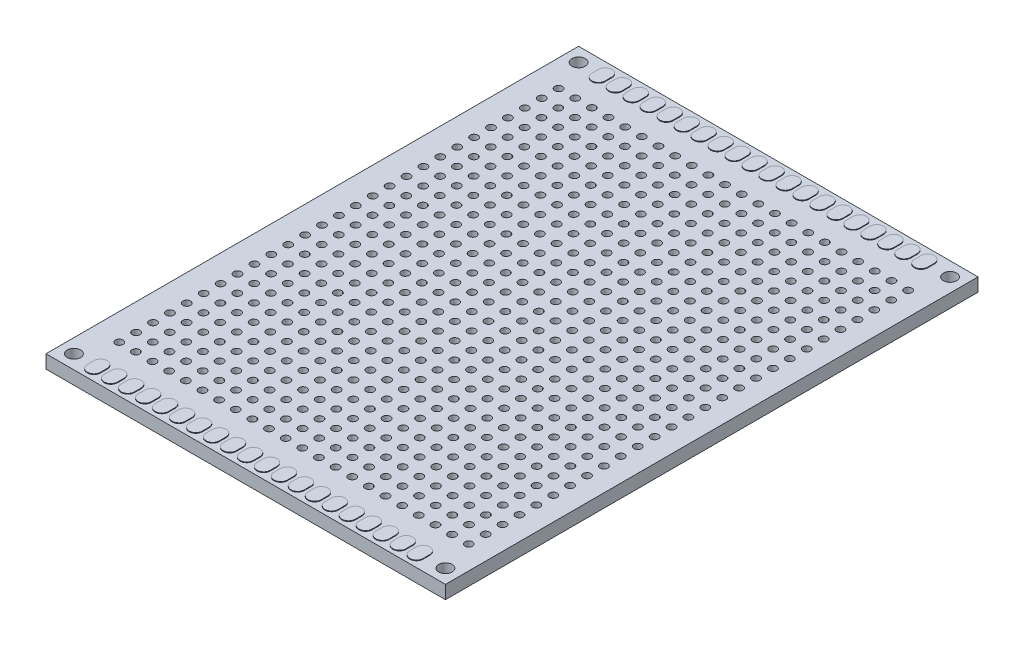
from build123d import *

# Parameters (mm, degrees)
SKETCH1_W           = 60
SKETCH1_H           = 80
SKETCH1_R           = 1
SKETCH1_R_2         = 0.575
BOSS_EXTRUDE1_DEPTH = 2
BOSS_EXTRUDE2_DEPTH = 0.1


with BuildPart() as part:
    # Sketch1 → Boss-Extrude1 (new body)
    with BuildSketch(Plane(origin=(0, 0, 0), x_dir=(1, 0, 0), z_dir=(0, 1, 0))):
        with Locations((30, 40)):
            Rectangle(SKETCH1_W, SKETCH1_H)
        with Locations((2.1, 77.9)):
            Circle(SKETCH1_R, mode=Mode.SUBTRACT)
        with Locations((57.9, 77.9)):
            Circle(SKETCH1_R, mode=Mode.SUBTRACT)
        with Locations((2.1, 2.1)):
            Circle(SKETCH1_R, mode=Mode.SUBTRACT)
        with Locations((57.9, 2.1)):
            Circle(SKETCH1_R, mode=Mode.SUBTRACT)
        with Locations((4, 73)):
            Circle(SKETCH1_R_2, mode=Mode.SUBTRACT)
        with Locations((6.5, 73)):
            Circle(SKETCH1_R_2, mode=Mode.SUBTRACT)
        with Locations((9, 73)):
            Circle(SKETCH1_R_2, mode=Mode.SUBTRACT)
        with Locations((11.5, 73)):
            Circle(SKETCH1_R_2, mode=Mode.SUBTRACT)
        with Locations((14, 73)):
            Circle(SKETCH1_R_2, mode=Mode.SUBTRACT)
        with Locations((16.5, 73)):
            Circle(SKETCH1_R_2, mode=Mode.SUBTRACT)
        with Locations((19, 73)):
            Circle(SKETCH1_R_2, mode=Mode.SUBTRACT)
        with Locations((21.5, 73)):
            Circle(SKETCH1_R_2, mode=Mode.SUBTRACT)
        with Locations((24, 73)):
            Circle(SKETCH1_R_2, mode=Mode.SUBTRACT)
        with Locations((26.5, 73)):
            Circle(SKETCH1_R_2, mode=Mode.SUBTRACT)
        with Locations((29, 73)):
            Circle(SKETCH1_R_2, mode=Mode.SUBTRACT)
        with Locations((31.5, 73)):
            Circle(SKETCH1_R_2, mode=Mode.SUBTRACT)
        with Locations((34, 73)):
            Circle(SKETCH1_R_2, mode=Mode.SUBTRACT)
        with Locations((36.5, 73)):
            Circle(SKETCH1_R_2, mode=Mode.SUBTRACT)
        with Locations((39, 73)):
            Circle(SKETCH1_R_2, mode=Mode.SUBTRACT)
        with Locations((41.5, 73)):
            Circle(SKETCH1_R_2, mode=Mode.SUBTRACT)
        with Locations((44, 73)):
            Circle(SKETCH1_R_2, mode=Mode.SUBTRACT)
        with Locations((46.5, 73)):
            Circle(SKETCH1_R_2, mode=Mode.SUBTRACT)
        with Locations((49, 73)):
            Circle(SKETCH1_R_2, mode=Mode.SUBTRACT)
        with Locations((51.5, 73)):
            Circle(SKETCH1_R_2, mode=Mode.SUBTRACT)
        with Locations((54, 73)):
            Circle(SKETCH1_R_2, mode=Mode.SUBTRACT)
        with Locations((56.5, 73)):
            Circle(SKETCH1_R_2, mode=Mode.SUBTRACT)
        with Locations((6.5, 70.461538462)):
            Circle(SKETCH1_R_2, mode=Mode.SUBTRACT)
        with Locations((9, 70.461538462)):
            Circle(SKETCH1_R_2, mode=Mode.SUBTRACT)
        with Locations((11.5, 70.461538462)):
            Circle(SKETCH1_R_2, mode=Mode.SUBTRACT)
        with Locations((14, 70.461538462)):
            Circle(SKETCH1_R_2, mode=Mode.SUBTRACT)
        with Locations((16.5, 70.461538462)):
            Circle(SKETCH1_R_2, mode=Mode.SUBTRACT)
        with Locations((19, 70.461538462)):
            Circle(SKETCH1_R_2, mode=Mode.SUBTRACT)
        with Locations((21.5, 70.461538462)):
            Circle(SKETCH1_R_2, mode=Mode.SUBTRACT)
        with Locations((24, 70.461538462)):
            Circle(SKETCH1_R_2, mode=Mode.SUBTRACT)
        with Locations((26.5, 70.461538462)):
            Circle(SKETCH1_R_2, mode=Mode.SUBTRACT)
        with Locations((29, 70.461538462)):
            Circle(SKETCH1_R_2, mode=Mode.SUBTRACT)
        with Locations((31.5, 70.461538462)):
            Circle(SKETCH1_R_2, mode=Mode.SUBTRACT)
        with Locations((34, 70.461538462)):
            Circle(SKETCH1_R_2, mode=Mode.SUBTRACT)
        with Locations((36.5, 70.461538462)):
            Circle(SKETCH1_R_2, mode=Mode.SUBTRACT)
        with Locations((39, 70.461538462)):
            Circle(SKETCH1_R_2, mode=Mode.SUBTRACT)
        with Locations((41.5, 70.461538462)):
            Circle(SKETCH1_R_2, mode=Mode.SUBTRACT)
        with Locations((44, 70.461538462)):
            Circle(SKETCH1_R_2, mode=Mode.SUBTRACT)
        with Locations((46.5, 70.461538462)):
            Circle(SKETCH1_R_2, mode=Mode.SUBTRACT)
        with Locations((49, 70.461538462)):
            Circle(SKETCH1_R_2, mode=Mode.SUBTRACT)
        with Locations((51.5, 70.461538462)):
            Circle(SKETCH1_R_2, mode=Mode.SUBTRACT)
        with Locations((54, 70.461538462)):
            Circle(SKETCH1_R_2, mode=Mode.SUBTRACT)
        with Locations((56.5, 70.461538462)):
            Circle(SKETCH1_R_2, mode=Mode.SUBTRACT)
        with Locations((6.5, 67.923076923)):
            Circle(SKETCH1_R_2, mode=Mode.SUBTRACT)
        with Locations((9, 67.923076923)):
            Circle(SKETCH1_R_2, mode=Mode.SUBTRACT)
        with Locations((11.5, 67.923076923)):
            Circle(SKETCH1_R_2, mode=Mode.SUBTRACT)
        with Locations((14, 67.923076923)):
            Circle(SKETCH1_R_2, mode=Mode.SUBTRACT)
        with Locations((16.5, 67.923076923)):
            Circle(SKETCH1_R_2, mode=Mode.SUBTRACT)
        with Locations((19, 67.923076923)):
            Circle(SKETCH1_R_2, mode=Mode.SUBTRACT)
        with Locations((21.5, 67.923076923)):
            Circle(SKETCH1_R_2, mode=Mode.SUBTRACT)
        with Locations((24, 67.923076923)):
            Circle(SKETCH1_R_2, mode=Mode.SUBTRACT)
        with Locations((26.5, 67.923076923)):
            Circle(SKETCH1_R_2, mode=Mode.SUBTRACT)
        with Locations((29, 67.923076923)):
            Circle(SKETCH1_R_2, mode=Mode.SUBTRACT)
        with Locations((31.5, 67.923076923)):
            Circle(SKETCH1_R_2, mode=Mode.SUBTRACT)
        with Locations((34, 67.923076923)):
            Circle(SKETCH1_R_2, mode=Mode.SUBTRACT)
        with Locations((36.5, 67.923076923)):
            Circle(SKETCH1_R_2, mode=Mode.SUBTRACT)
        with Locations((39, 67.923076923)):
            Circle(SKETCH1_R_2, mode=Mode.SUBTRACT)
        with Locations((41.5, 67.923076923)):
            Circle(SKETCH1_R_2, mode=Mode.SUBTRACT)
        with Locations((44, 67.923076923)):
            Circle(SKETCH1_R_2, mode=Mode.SUBTRACT)
        with Locations((46.5, 67.923076923)):
            Circle(SKETCH1_R_2, mode=Mode.SUBTRACT)
        with Locations((49, 67.923076923)):
            Circle(SKETCH1_R_2, mode=Mode.SUBTRACT)
        with Locations((51.5, 67.923076923)):
            Circle(SKETCH1_R_2, mode=Mode.SUBTRACT)
        with Locations((54, 67.923076923)):
            Circle(SKETCH1_R_2, mode=Mode.SUBTRACT)
        with Locations((56.5, 67.923076923)):
            Circle(SKETCH1_R_2, mode=Mode.SUBTRACT)
        with Locations((6.5, 65.384615385)):
            Circle(SKETCH1_R_2, mode=Mode.SUBTRACT)
        with Locations((9, 65.384615385)):
            Circle(SKETCH1_R_2, mode=Mode.SUBTRACT)
        with Locations((11.5, 65.384615385)):
            Circle(SKETCH1_R_2, mode=Mode.SUBTRACT)
        with Locations((14, 65.384615385)):
            Circle(SKETCH1_R_2, mode=Mode.SUBTRACT)
        with Locations((16.5, 65.384615385)):
            Circle(SKETCH1_R_2, mode=Mode.SUBTRACT)
        with Locations((19, 65.384615385)):
            Circle(SKETCH1_R_2, mode=Mode.SUBTRACT)
        with Locations((21.5, 65.384615385)):
            Circle(SKETCH1_R_2, mode=Mode.SUBTRACT)
        with Locations((24, 65.384615385)):
            Circle(SKETCH1_R_2, mode=Mode.SUBTRACT)
        with Locations((26.5, 65.384615385)):
            Circle(SKETCH1_R_2, mode=Mode.SUBTRACT)
        with Locations((29, 65.384615385)):
            Circle(SKETCH1_R_2, mode=Mode.SUBTRACT)
        with Locations((31.5, 65.384615385)):
            Circle(SKETCH1_R_2, mode=Mode.SUBTRACT)
        with Locations((34, 65.384615385)):
            Circle(SKETCH1_R_2, mode=Mode.SUBTRACT)
        with Locations((36.5, 65.384615385)):
            Circle(SKETCH1_R_2, mode=Mode.SUBTRACT)
        with Locations((39, 65.384615385)):
            Circle(SKETCH1_R_2, mode=Mode.SUBTRACT)
        with Locations((41.5, 65.384615385)):
            Circle(SKETCH1_R_2, mode=Mode.SUBTRACT)
        with Locations((44, 65.384615385)):
            Circle(SKETCH1_R_2, mode=Mode.SUBTRACT)
        with Locations((46.5, 65.384615385)):
            Circle(SKETCH1_R_2, mode=Mode.SUBTRACT)
        with Locations((49, 65.384615385)):
            Circle(SKETCH1_R_2, mode=Mode.SUBTRACT)
        with Locations((51.5, 65.384615385)):
            Circle(SKETCH1_R_2, mode=Mode.SUBTRACT)
        with Locations((54, 65.384615385)):
            Circle(SKETCH1_R_2, mode=Mode.SUBTRACT)
        with Locations((56.5, 65.384615385)):
            Circle(SKETCH1_R_2, mode=Mode.SUBTRACT)
        with Locations((6.5, 62.846153846)):
            Circle(SKETCH1_R_2, mode=Mode.SUBTRACT)
        with Locations((9, 62.846153846)):
            Circle(SKETCH1_R_2, mode=Mode.SUBTRACT)
        with Locations((11.5, 62.846153846)):
            Circle(SKETCH1_R_2, mode=Mode.SUBTRACT)
        with Locations((14, 62.846153846)):
            Circle(SKETCH1_R_2, mode=Mode.SUBTRACT)
        with Locations((16.5, 62.846153846)):
            Circle(SKETCH1_R_2, mode=Mode.SUBTRACT)
        with Locations((19, 62.846153846)):
            Circle(SKETCH1_R_2, mode=Mode.SUBTRACT)
        with Locations((21.5, 62.846153846)):
            Circle(SKETCH1_R_2, mode=Mode.SUBTRACT)
        with Locations((24, 62.846153846)):
            Circle(SKETCH1_R_2, mode=Mode.SUBTRACT)
        with Locations((26.5, 62.846153846)):
            Circle(SKETCH1_R_2, mode=Mode.SUBTRACT)
        with Locations((29, 62.846153846)):
            Circle(SKETCH1_R_2, mode=Mode.SUBTRACT)
        with Locations((31.5, 62.846153846)):
            Circle(SKETCH1_R_2, mode=Mode.SUBTRACT)
        with Locations((34, 62.846153846)):
            Circle(SKETCH1_R_2, mode=Mode.SUBTRACT)
        with Locations((36.5, 62.846153846)):
            Circle(SKETCH1_R_2, mode=Mode.SUBTRACT)
        with Locations((39, 62.846153846)):
            Circle(SKETCH1_R_2, mode=Mode.SUBTRACT)
        with Locations((41.5, 62.846153846)):
            Circle(SKETCH1_R_2, mode=Mode.SUBTRACT)
        with Locations((44, 62.846153846)):
            Circle(SKETCH1_R_2, mode=Mode.SUBTRACT)
        with Locations((46.5, 62.846153846)):
            Circle(SKETCH1_R_2, mode=Mode.SUBTRACT)
        with Locations((49, 62.846153846)):
            Circle(SKETCH1_R_2, mode=Mode.SUBTRACT)
        with Locations((51.5, 62.846153846)):
            Circle(SKETCH1_R_2, mode=Mode.SUBTRACT)
        with Locations((54, 62.846153846)):
            Circle(SKETCH1_R_2, mode=Mode.SUBTRACT)
        with Locations((56.5, 62.846153846)):
            Circle(SKETCH1_R_2, mode=Mode.SUBTRACT)
        with Locations((6.5, 60.307692308)):
            Circle(SKETCH1_R_2, mode=Mode.SUBTRACT)
        with Locations((9, 60.307692308)):
            Circle(SKETCH1_R_2, mode=Mode.SUBTRACT)
        with Locations((11.5, 60.307692308)):
            Circle(SKETCH1_R_2, mode=Mode.SUBTRACT)
        with Locations((14, 60.307692308)):
            Circle(SKETCH1_R_2, mode=Mode.SUBTRACT)
        with Locations((16.5, 60.307692308)):
            Circle(SKETCH1_R_2, mode=Mode.SUBTRACT)
        with Locations((19, 60.307692308)):
            Circle(SKETCH1_R_2, mode=Mode.SUBTRACT)
        with Locations((21.5, 60.307692308)):
            Circle(SKETCH1_R_2, mode=Mode.SUBTRACT)
        with Locations((24, 60.307692308)):
            Circle(SKETCH1_R_2, mode=Mode.SUBTRACT)
        with Locations((26.5, 60.307692308)):
            Circle(SKETCH1_R_2, mode=Mode.SUBTRACT)
        with Locations((29, 60.307692308)):
            Circle(SKETCH1_R_2, mode=Mode.SUBTRACT)
        with Locations((31.5, 60.307692308)):
            Circle(SKETCH1_R_2, mode=Mode.SUBTRACT)
        with Locations((34, 60.307692308)):
            Circle(SKETCH1_R_2, mode=Mode.SUBTRACT)
        with Locations((36.5, 60.307692308)):
            Circle(SKETCH1_R_2, mode=Mode.SUBTRACT)
        with Locations((39, 60.307692308)):
            Circle(SKETCH1_R_2, mode=Mode.SUBTRACT)
        with Locations((41.5, 60.307692308)):
            Circle(SKETCH1_R_2, mode=Mode.SUBTRACT)
        with Locations((44, 60.307692308)):
            Circle(SKETCH1_R_2, mode=Mode.SUBTRACT)
        with Locations((46.5, 60.307692308)):
            Circle(SKETCH1_R_2, mode=Mode.SUBTRACT)
        with Locations((49, 60.307692308)):
            Circle(SKETCH1_R_2, mode=Mode.SUBTRACT)
        with Locations((51.5, 60.307692308)):
            Circle(SKETCH1_R_2, mode=Mode.SUBTRACT)
        with Locations((54, 60.307692308)):
            Circle(SKETCH1_R_2, mode=Mode.SUBTRACT)
        with Locations((56.5, 60.307692308)):
            Circle(SKETCH1_R_2, mode=Mode.SUBTRACT)
        with Locations((6.5, 57.769230769)):
            Circle(SKETCH1_R_2, mode=Mode.SUBTRACT)
        with Locations((9, 57.769230769)):
            Circle(SKETCH1_R_2, mode=Mode.SUBTRACT)
        with Locations((11.5, 57.769230769)):
            Circle(SKETCH1_R_2, mode=Mode.SUBTRACT)
        with Locations((14, 57.769230769)):
            Circle(SKETCH1_R_2, mode=Mode.SUBTRACT)
        with Locations((16.5, 57.769230769)):
            Circle(SKETCH1_R_2, mode=Mode.SUBTRACT)
        with Locations((19, 57.769230769)):
            Circle(SKETCH1_R_2, mode=Mode.SUBTRACT)
        with Locations((21.5, 57.769230769)):
            Circle(SKETCH1_R_2, mode=Mode.SUBTRACT)
        with Locations((24, 57.769230769)):
            Circle(SKETCH1_R_2, mode=Mode.SUBTRACT)
        with Locations((26.5, 57.769230769)):
            Circle(SKETCH1_R_2, mode=Mode.SUBTRACT)
        with Locations((29, 57.769230769)):
            Circle(SKETCH1_R_2, mode=Mode.SUBTRACT)
        with Locations((31.5, 57.769230769)):
            Circle(SKETCH1_R_2, mode=Mode.SUBTRACT)
        with Locations((34, 57.769230769)):
            Circle(SKETCH1_R_2, mode=Mode.SUBTRACT)
        with Locations((36.5, 57.769230769)):
            Circle(SKETCH1_R_2, mode=Mode.SUBTRACT)
        with Locations((39, 57.769230769)):
            Circle(SKETCH1_R_2, mode=Mode.SUBTRACT)
        with Locations((41.5, 57.769230769)):
            Circle(SKETCH1_R_2, mode=Mode.SUBTRACT)
        with Locations((44, 57.769230769)):
            Circle(SKETCH1_R_2, mode=Mode.SUBTRACT)
        with Locations((46.5, 57.769230769)):
            Circle(SKETCH1_R_2, mode=Mode.SUBTRACT)
        with Locations((49, 57.769230769)):
            Circle(SKETCH1_R_2, mode=Mode.SUBTRACT)
        with Locations((51.5, 57.769230769)):
            Circle(SKETCH1_R_2, mode=Mode.SUBTRACT)
        with Locations((54, 57.769230769)):
            Circle(SKETCH1_R_2, mode=Mode.SUBTRACT)
        with Locations((56.5, 57.769230769)):
            Circle(SKETCH1_R_2, mode=Mode.SUBTRACT)
        with Locations((6.5, 55.230769231)):
            Circle(SKETCH1_R_2, mode=Mode.SUBTRACT)
        with Locations((9, 55.230769231)):
            Circle(SKETCH1_R_2, mode=Mode.SUBTRACT)
        with Locations((11.5, 55.230769231)):
            Circle(SKETCH1_R_2, mode=Mode.SUBTRACT)
        with Locations((14, 55.230769231)):
            Circle(SKETCH1_R_2, mode=Mode.SUBTRACT)
        with Locations((16.5, 55.230769231)):
            Circle(SKETCH1_R_2, mode=Mode.SUBTRACT)
        with Locations((19, 55.230769231)):
            Circle(SKETCH1_R_2, mode=Mode.SUBTRACT)
        with Locations((21.5, 55.230769231)):
            Circle(SKETCH1_R_2, mode=Mode.SUBTRACT)
        with Locations((24, 55.230769231)):
            Circle(SKETCH1_R_2, mode=Mode.SUBTRACT)
        with Locations((26.5, 55.230769231)):
            Circle(SKETCH1_R_2, mode=Mode.SUBTRACT)
        with Locations((29, 55.230769231)):
            Circle(SKETCH1_R_2, mode=Mode.SUBTRACT)
        with Locations((31.5, 55.230769231)):
            Circle(SKETCH1_R_2, mode=Mode.SUBTRACT)
        with Locations((34, 55.230769231)):
            Circle(SKETCH1_R_2, mode=Mode.SUBTRACT)
        with Locations((36.5, 55.230769231)):
            Circle(SKETCH1_R_2, mode=Mode.SUBTRACT)
        with Locations((39, 55.230769231)):
            Circle(SKETCH1_R_2, mode=Mode.SUBTRACT)
        with Locations((41.5, 55.230769231)):
            Circle(SKETCH1_R_2, mode=Mode.SUBTRACT)
        with Locations((44, 55.230769231)):
            Circle(SKETCH1_R_2, mode=Mode.SUBTRACT)
        with Locations((46.5, 55.230769231)):
            Circle(SKETCH1_R_2, mode=Mode.SUBTRACT)
        with Locations((49, 55.230769231)):
            Circle(SKETCH1_R_2, mode=Mode.SUBTRACT)
        with Locations((51.5, 55.230769231)):
            Circle(SKETCH1_R_2, mode=Mode.SUBTRACT)
        with Locations((54, 55.230769231)):
            Circle(SKETCH1_R_2, mode=Mode.SUBTRACT)
        with Locations((56.5, 55.230769231)):
            Circle(SKETCH1_R_2, mode=Mode.SUBTRACT)
        with Locations((6.5, 52.692307692)):
            Circle(SKETCH1_R_2, mode=Mode.SUBTRACT)
        with Locations((9, 52.692307692)):
            Circle(SKETCH1_R_2, mode=Mode.SUBTRACT)
        with Locations((11.5, 52.692307692)):
            Circle(SKETCH1_R_2, mode=Mode.SUBTRACT)
        with Locations((14, 52.692307692)):
            Circle(SKETCH1_R_2, mode=Mode.SUBTRACT)
        with Locations((16.5, 52.692307692)):
            Circle(SKETCH1_R_2, mode=Mode.SUBTRACT)
        with Locations((19, 52.692307692)):
            Circle(SKETCH1_R_2, mode=Mode.SUBTRACT)
        with Locations((21.5, 52.692307692)):
            Circle(SKETCH1_R_2, mode=Mode.SUBTRACT)
        with Locations((24, 52.692307692)):
            Circle(SKETCH1_R_2, mode=Mode.SUBTRACT)
        with Locations((26.5, 52.692307692)):
            Circle(SKETCH1_R_2, mode=Mode.SUBTRACT)
        with Locations((29, 52.692307692)):
            Circle(SKETCH1_R_2, mode=Mode.SUBTRACT)
        with Locations((31.5, 52.692307692)):
            Circle(SKETCH1_R_2, mode=Mode.SUBTRACT)
        with Locations((34, 52.692307692)):
            Circle(SKETCH1_R_2, mode=Mode.SUBTRACT)
        with Locations((36.5, 52.692307692)):
            Circle(SKETCH1_R_2, mode=Mode.SUBTRACT)
        with Locations((39, 52.692307692)):
            Circle(SKETCH1_R_2, mode=Mode.SUBTRACT)
        with Locations((41.5, 52.692307692)):
            Circle(SKETCH1_R_2, mode=Mode.SUBTRACT)
        with Locations((44, 52.692307692)):
            Circle(SKETCH1_R_2, mode=Mode.SUBTRACT)
        with Locations((46.5, 52.692307692)):
            Circle(SKETCH1_R_2, mode=Mode.SUBTRACT)
        with Locations((49, 52.692307692)):
            Circle(SKETCH1_R_2, mode=Mode.SUBTRACT)
        with Locations((51.5, 52.692307692)):
            Circle(SKETCH1_R_2, mode=Mode.SUBTRACT)
        with Locations((54, 52.692307692)):
            Circle(SKETCH1_R_2, mode=Mode.SUBTRACT)
        with Locations((56.5, 52.692307692)):
            Circle(SKETCH1_R_2, mode=Mode.SUBTRACT)
        with Locations((6.5, 50.153846154)):
            Circle(SKETCH1_R_2, mode=Mode.SUBTRACT)
        with Locations((9, 50.153846154)):
            Circle(SKETCH1_R_2, mode=Mode.SUBTRACT)
        with Locations((11.5, 50.153846154)):
            Circle(SKETCH1_R_2, mode=Mode.SUBTRACT)
        with Locations((14, 50.153846154)):
            Circle(SKETCH1_R_2, mode=Mode.SUBTRACT)
        with Locations((16.5, 50.153846154)):
            Circle(SKETCH1_R_2, mode=Mode.SUBTRACT)
        with Locations((19, 50.153846154)):
            Circle(SKETCH1_R_2, mode=Mode.SUBTRACT)
        with Locations((21.5, 50.153846154)):
            Circle(SKETCH1_R_2, mode=Mode.SUBTRACT)
        with Locations((24, 50.153846154)):
            Circle(SKETCH1_R_2, mode=Mode.SUBTRACT)
        with Locations((26.5, 50.153846154)):
            Circle(SKETCH1_R_2, mode=Mode.SUBTRACT)
        with Locations((29, 50.153846154)):
            Circle(SKETCH1_R_2, mode=Mode.SUBTRACT)
        with Locations((31.5, 50.153846154)):
            Circle(SKETCH1_R_2, mode=Mode.SUBTRACT)
        with Locations((34, 50.153846154)):
            Circle(SKETCH1_R_2, mode=Mode.SUBTRACT)
        with Locations((36.5, 50.153846154)):
            Circle(SKETCH1_R_2, mode=Mode.SUBTRACT)
        with Locations((39, 50.153846154)):
            Circle(SKETCH1_R_2, mode=Mode.SUBTRACT)
        with Locations((41.5, 50.153846154)):
            Circle(SKETCH1_R_2, mode=Mode.SUBTRACT)
        with Locations((44, 50.153846154)):
            Circle(SKETCH1_R_2, mode=Mode.SUBTRACT)
        with Locations((46.5, 50.153846154)):
            Circle(SKETCH1_R_2, mode=Mode.SUBTRACT)
        with Locations((49, 50.153846154)):
            Circle(SKETCH1_R_2, mode=Mode.SUBTRACT)
        with Locations((51.5, 50.153846154)):
            Circle(SKETCH1_R_2, mode=Mode.SUBTRACT)
        with Locations((54, 50.153846154)):
            Circle(SKETCH1_R_2, mode=Mode.SUBTRACT)
        with Locations((56.5, 50.153846154)):
            Circle(SKETCH1_R_2, mode=Mode.SUBTRACT)
        with Locations((6.5, 47.615384615)):
            Circle(SKETCH1_R_2, mode=Mode.SUBTRACT)
        with Locations((9, 47.615384615)):
            Circle(SKETCH1_R_2, mode=Mode.SUBTRACT)
        with Locations((11.5, 47.615384615)):
            Circle(SKETCH1_R_2, mode=Mode.SUBTRACT)
        with Locations((14, 47.615384615)):
            Circle(SKETCH1_R_2, mode=Mode.SUBTRACT)
        with Locations((16.5, 47.615384615)):
            Circle(SKETCH1_R_2, mode=Mode.SUBTRACT)
        with Locations((19, 47.615384615)):
            Circle(SKETCH1_R_2, mode=Mode.SUBTRACT)
        with Locations((21.5, 47.615384615)):
            Circle(SKETCH1_R_2, mode=Mode.SUBTRACT)
        with Locations((24, 47.615384615)):
            Circle(SKETCH1_R_2, mode=Mode.SUBTRACT)
        with Locations((26.5, 47.615384615)):
            Circle(SKETCH1_R_2, mode=Mode.SUBTRACT)
        with Locations((29, 47.615384615)):
            Circle(SKETCH1_R_2, mode=Mode.SUBTRACT)
        with Locations((31.5, 47.615384615)):
            Circle(SKETCH1_R_2, mode=Mode.SUBTRACT)
        with Locations((34, 47.615384615)):
            Circle(SKETCH1_R_2, mode=Mode.SUBTRACT)
        with Locations((36.5, 47.615384615)):
            Circle(SKETCH1_R_2, mode=Mode.SUBTRACT)
        with Locations((39, 47.615384615)):
            Circle(SKETCH1_R_2, mode=Mode.SUBTRACT)
        with Locations((41.5, 47.615384615)):
            Circle(SKETCH1_R_2, mode=Mode.SUBTRACT)
        with Locations((44, 47.615384615)):
            Circle(SKETCH1_R_2, mode=Mode.SUBTRACT)
        with Locations((46.5, 47.615384615)):
            Circle(SKETCH1_R_2, mode=Mode.SUBTRACT)
        with Locations((49, 47.615384615)):
            Circle(SKETCH1_R_2, mode=Mode.SUBTRACT)
        with Locations((51.5, 47.615384615)):
            Circle(SKETCH1_R_2, mode=Mode.SUBTRACT)
        with Locations((54, 47.615384615)):
            Circle(SKETCH1_R_2, mode=Mode.SUBTRACT)
        with Locations((56.5, 47.615384615)):
            Circle(SKETCH1_R_2, mode=Mode.SUBTRACT)
        with Locations((6.5, 45.076923077)):
            Circle(SKETCH1_R_2, mode=Mode.SUBTRACT)
        with Locations((9, 45.076923077)):
            Circle(SKETCH1_R_2, mode=Mode.SUBTRACT)
        with Locations((11.5, 45.076923077)):
            Circle(SKETCH1_R_2, mode=Mode.SUBTRACT)
        with Locations((14, 45.076923077)):
            Circle(SKETCH1_R_2, mode=Mode.SUBTRACT)
        with Locations((16.5, 45.076923077)):
            Circle(SKETCH1_R_2, mode=Mode.SUBTRACT)
        with Locations((19, 45.076923077)):
            Circle(SKETCH1_R_2, mode=Mode.SUBTRACT)
        with Locations((21.5, 45.076923077)):
            Circle(SKETCH1_R_2, mode=Mode.SUBTRACT)
        with Locations((24, 45.076923077)):
            Circle(SKETCH1_R_2, mode=Mode.SUBTRACT)
        with Locations((26.5, 45.076923077)):
            Circle(SKETCH1_R_2, mode=Mode.SUBTRACT)
        with Locations((29, 45.076923077)):
            Circle(SKETCH1_R_2, mode=Mode.SUBTRACT)
        with Locations((31.5, 45.076923077)):
            Circle(SKETCH1_R_2, mode=Mode.SUBTRACT)
        with Locations((34, 45.076923077)):
            Circle(SKETCH1_R_2, mode=Mode.SUBTRACT)
        with Locations((36.5, 45.076923077)):
            Circle(SKETCH1_R_2, mode=Mode.SUBTRACT)
        with Locations((39, 45.076923077)):
            Circle(SKETCH1_R_2, mode=Mode.SUBTRACT)
        with Locations((41.5, 45.076923077)):
            Circle(SKETCH1_R_2, mode=Mode.SUBTRACT)
        with Locations((44, 45.076923077)):
            Circle(SKETCH1_R_2, mode=Mode.SUBTRACT)
        with Locations((46.5, 45.076923077)):
            Circle(SKETCH1_R_2, mode=Mode.SUBTRACT)
        with Locations((49, 45.076923077)):
            Circle(SKETCH1_R_2, mode=Mode.SUBTRACT)
        with Locations((51.5, 45.076923077)):
            Circle(SKETCH1_R_2, mode=Mode.SUBTRACT)
        with Locations((54, 45.076923077)):
            Circle(SKETCH1_R_2, mode=Mode.SUBTRACT)
        with Locations((56.5, 45.076923077)):
            Circle(SKETCH1_R_2, mode=Mode.SUBTRACT)
        with Locations((6.5, 42.538461538)):
            Circle(SKETCH1_R_2, mode=Mode.SUBTRACT)
        with Locations((9, 42.538461538)):
            Circle(SKETCH1_R_2, mode=Mode.SUBTRACT)
        with Locations((11.5, 42.538461538)):
            Circle(SKETCH1_R_2, mode=Mode.SUBTRACT)
        with Locations((14, 42.538461538)):
            Circle(SKETCH1_R_2, mode=Mode.SUBTRACT)
        with Locations((16.5, 42.538461538)):
            Circle(SKETCH1_R_2, mode=Mode.SUBTRACT)
        with Locations((19, 42.538461538)):
            Circle(SKETCH1_R_2, mode=Mode.SUBTRACT)
        with Locations((21.5, 42.538461538)):
            Circle(SKETCH1_R_2, mode=Mode.SUBTRACT)
        with Locations((24, 42.538461538)):
            Circle(SKETCH1_R_2, mode=Mode.SUBTRACT)
        with Locations((26.5, 42.538461538)):
            Circle(SKETCH1_R_2, mode=Mode.SUBTRACT)
        with Locations((29, 42.538461538)):
            Circle(SKETCH1_R_2, mode=Mode.SUBTRACT)
        with Locations((31.5, 42.538461538)):
            Circle(SKETCH1_R_2, mode=Mode.SUBTRACT)
        with Locations((34, 42.538461538)):
            Circle(SKETCH1_R_2, mode=Mode.SUBTRACT)
        with Locations((36.5, 42.538461538)):
            Circle(SKETCH1_R_2, mode=Mode.SUBTRACT)
        with Locations((39, 42.538461538)):
            Circle(SKETCH1_R_2, mode=Mode.SUBTRACT)
        with Locations((41.5, 42.538461538)):
            Circle(SKETCH1_R_2, mode=Mode.SUBTRACT)
        with Locations((44, 42.538461538)):
            Circle(SKETCH1_R_2, mode=Mode.SUBTRACT)
        with Locations((46.5, 42.538461538)):
            Circle(SKETCH1_R_2, mode=Mode.SUBTRACT)
        with Locations((49, 42.538461538)):
            Circle(SKETCH1_R_2, mode=Mode.SUBTRACT)
        with Locations((51.5, 42.538461538)):
            Circle(SKETCH1_R_2, mode=Mode.SUBTRACT)
        with Locations((54, 42.538461538)):
            Circle(SKETCH1_R_2, mode=Mode.SUBTRACT)
        with Locations((56.5, 42.538461538)):
            Circle(SKETCH1_R_2, mode=Mode.SUBTRACT)
        with Locations((6.5, 40)):
            Circle(SKETCH1_R_2, mode=Mode.SUBTRACT)
        with Locations((9, 40)):
            Circle(SKETCH1_R_2, mode=Mode.SUBTRACT)
        with Locations((11.5, 40)):
            Circle(SKETCH1_R_2, mode=Mode.SUBTRACT)
        with Locations((14, 40)):
            Circle(SKETCH1_R_2, mode=Mode.SUBTRACT)
        with Locations((16.5, 40)):
            Circle(SKETCH1_R_2, mode=Mode.SUBTRACT)
        with Locations((19, 40)):
            Circle(SKETCH1_R_2, mode=Mode.SUBTRACT)
        with Locations((21.5, 40)):
            Circle(SKETCH1_R_2, mode=Mode.SUBTRACT)
        with Locations((24, 40)):
            Circle(SKETCH1_R_2, mode=Mode.SUBTRACT)
        with Locations((26.5, 40)):
            Circle(SKETCH1_R_2, mode=Mode.SUBTRACT)
        with Locations((29, 40)):
            Circle(SKETCH1_R_2, mode=Mode.SUBTRACT)
        with Locations((31.5, 40)):
            Circle(SKETCH1_R_2, mode=Mode.SUBTRACT)
        with Locations((34, 40)):
            Circle(SKETCH1_R_2, mode=Mode.SUBTRACT)
        with Locations((36.5, 40)):
            Circle(SKETCH1_R_2, mode=Mode.SUBTRACT)
        with Locations((39, 40)):
            Circle(SKETCH1_R_2, mode=Mode.SUBTRACT)
        with Locations((41.5, 40)):
            Circle(SKETCH1_R_2, mode=Mode.SUBTRACT)
        with Locations((44, 40)):
            Circle(SKETCH1_R_2, mode=Mode.SUBTRACT)
        with Locations((46.5, 40)):
            Circle(SKETCH1_R_2, mode=Mode.SUBTRACT)
        with Locations((49, 40)):
            Circle(SKETCH1_R_2, mode=Mode.SUBTRACT)
        with Locations((51.5, 40)):
            Circle(SKETCH1_R_2, mode=Mode.SUBTRACT)
        with Locations((54, 40)):
            Circle(SKETCH1_R_2, mode=Mode.SUBTRACT)
        with Locations((56.5, 40)):
            Circle(SKETCH1_R_2, mode=Mode.SUBTRACT)
        with Locations((6.5, 37.461538462)):
            Circle(SKETCH1_R_2, mode=Mode.SUBTRACT)
        with Locations((9, 37.461538462)):
            Circle(SKETCH1_R_2, mode=Mode.SUBTRACT)
        with Locations((11.5, 37.461538462)):
            Circle(SKETCH1_R_2, mode=Mode.SUBTRACT)
        with Locations((14, 37.461538462)):
            Circle(SKETCH1_R_2, mode=Mode.SUBTRACT)
        with Locations((16.5, 37.461538462)):
            Circle(SKETCH1_R_2, mode=Mode.SUBTRACT)
        with Locations((19, 37.461538462)):
            Circle(SKETCH1_R_2, mode=Mode.SUBTRACT)
        with Locations((21.5, 37.461538462)):
            Circle(SKETCH1_R_2, mode=Mode.SUBTRACT)
        with Locations((24, 37.461538462)):
            Circle(SKETCH1_R_2, mode=Mode.SUBTRACT)
        with Locations((26.5, 37.461538462)):
            Circle(SKETCH1_R_2, mode=Mode.SUBTRACT)
        with Locations((29, 37.461538462)):
            Circle(SKETCH1_R_2, mode=Mode.SUBTRACT)
        with Locations((31.5, 37.461538462)):
            Circle(SKETCH1_R_2, mode=Mode.SUBTRACT)
        with Locations((34, 37.461538462)):
            Circle(SKETCH1_R_2, mode=Mode.SUBTRACT)
        with Locations((36.5, 37.461538462)):
            Circle(SKETCH1_R_2, mode=Mode.SUBTRACT)
        with Locations((39, 37.461538462)):
            Circle(SKETCH1_R_2, mode=Mode.SUBTRACT)
        with Locations((41.5, 37.461538462)):
            Circle(SKETCH1_R_2, mode=Mode.SUBTRACT)
        with Locations((44, 37.461538462)):
            Circle(SKETCH1_R_2, mode=Mode.SUBTRACT)
        with Locations((46.5, 37.461538462)):
            Circle(SKETCH1_R_2, mode=Mode.SUBTRACT)
        with Locations((49, 37.461538462)):
            Circle(SKETCH1_R_2, mode=Mode.SUBTRACT)
        with Locations((51.5, 37.461538462)):
            Circle(SKETCH1_R_2, mode=Mode.SUBTRACT)
        with Locations((54, 37.461538462)):
            Circle(SKETCH1_R_2, mode=Mode.SUBTRACT)
        with Locations((56.5, 37.461538462)):
            Circle(SKETCH1_R_2, mode=Mode.SUBTRACT)
        with Locations((6.5, 34.923076923)):
            Circle(SKETCH1_R_2, mode=Mode.SUBTRACT)
        with Locations((9, 34.923076923)):
            Circle(SKETCH1_R_2, mode=Mode.SUBTRACT)
        with Locations((11.5, 34.923076923)):
            Circle(SKETCH1_R_2, mode=Mode.SUBTRACT)
        with Locations((14, 34.923076923)):
            Circle(SKETCH1_R_2, mode=Mode.SUBTRACT)
        with Locations((16.5, 34.923076923)):
            Circle(SKETCH1_R_2, mode=Mode.SUBTRACT)
        with Locations((19, 34.923076923)):
            Circle(SKETCH1_R_2, mode=Mode.SUBTRACT)
        with Locations((21.5, 34.923076923)):
            Circle(SKETCH1_R_2, mode=Mode.SUBTRACT)
        with Locations((24, 34.923076923)):
            Circle(SKETCH1_R_2, mode=Mode.SUBTRACT)
        with Locations((26.5, 34.923076923)):
            Circle(SKETCH1_R_2, mode=Mode.SUBTRACT)
        with Locations((29, 34.923076923)):
            Circle(SKETCH1_R_2, mode=Mode.SUBTRACT)
        with Locations((31.5, 34.923076923)):
            Circle(SKETCH1_R_2, mode=Mode.SUBTRACT)
        with Locations((34, 34.923076923)):
            Circle(SKETCH1_R_2, mode=Mode.SUBTRACT)
        with Locations((36.5, 34.923076923)):
            Circle(SKETCH1_R_2, mode=Mode.SUBTRACT)
        with Locations((39, 34.923076923)):
            Circle(SKETCH1_R_2, mode=Mode.SUBTRACT)
        with Locations((41.5, 34.923076923)):
            Circle(SKETCH1_R_2, mode=Mode.SUBTRACT)
        with Locations((44, 34.923076923)):
            Circle(SKETCH1_R_2, mode=Mode.SUBTRACT)
        with Locations((46.5, 34.923076923)):
            Circle(SKETCH1_R_2, mode=Mode.SUBTRACT)
        with Locations((49, 34.923076923)):
            Circle(SKETCH1_R_2, mode=Mode.SUBTRACT)
        with Locations((51.5, 34.923076923)):
            Circle(SKETCH1_R_2, mode=Mode.SUBTRACT)
        with Locations((54, 34.923076923)):
            Circle(SKETCH1_R_2, mode=Mode.SUBTRACT)
        with Locations((56.5, 34.923076923)):
            Circle(SKETCH1_R_2, mode=Mode.SUBTRACT)
        with Locations((6.5, 32.384615385)):
            Circle(SKETCH1_R_2, mode=Mode.SUBTRACT)
        with Locations((9, 32.384615385)):
            Circle(SKETCH1_R_2, mode=Mode.SUBTRACT)
        with Locations((11.5, 32.384615385)):
            Circle(SKETCH1_R_2, mode=Mode.SUBTRACT)
        with Locations((14, 32.384615385)):
            Circle(SKETCH1_R_2, mode=Mode.SUBTRACT)
        with Locations((16.5, 32.384615385)):
            Circle(SKETCH1_R_2, mode=Mode.SUBTRACT)
        with Locations((19, 32.384615385)):
            Circle(SKETCH1_R_2, mode=Mode.SUBTRACT)
        with Locations((21.5, 32.384615385)):
            Circle(SKETCH1_R_2, mode=Mode.SUBTRACT)
        with Locations((24, 32.384615385)):
            Circle(SKETCH1_R_2, mode=Mode.SUBTRACT)
        with Locations((26.5, 32.384615385)):
            Circle(SKETCH1_R_2, mode=Mode.SUBTRACT)
        with Locations((29, 32.384615385)):
            Circle(SKETCH1_R_2, mode=Mode.SUBTRACT)
        with Locations((31.5, 32.384615385)):
            Circle(SKETCH1_R_2, mode=Mode.SUBTRACT)
        with Locations((34, 32.384615385)):
            Circle(SKETCH1_R_2, mode=Mode.SUBTRACT)
        with Locations((36.5, 32.384615385)):
            Circle(SKETCH1_R_2, mode=Mode.SUBTRACT)
        with Locations((39, 32.384615385)):
            Circle(SKETCH1_R_2, mode=Mode.SUBTRACT)
        with Locations((41.5, 32.384615385)):
            Circle(SKETCH1_R_2, mode=Mode.SUBTRACT)
        with Locations((44, 32.384615385)):
            Circle(SKETCH1_R_2, mode=Mode.SUBTRACT)
        with Locations((46.5, 32.384615385)):
            Circle(SKETCH1_R_2, mode=Mode.SUBTRACT)
        with Locations((49, 32.384615385)):
            Circle(SKETCH1_R_2, mode=Mode.SUBTRACT)
        with Locations((51.5, 32.384615385)):
            Circle(SKETCH1_R_2, mode=Mode.SUBTRACT)
        with Locations((54, 32.384615385)):
            Circle(SKETCH1_R_2, mode=Mode.SUBTRACT)
        with Locations((56.5, 32.384615385)):
            Circle(SKETCH1_R_2, mode=Mode.SUBTRACT)
        with Locations((6.5, 29.846153846)):
            Circle(SKETCH1_R_2, mode=Mode.SUBTRACT)
        with Locations((9, 29.846153846)):
            Circle(SKETCH1_R_2, mode=Mode.SUBTRACT)
        with Locations((11.5, 29.846153846)):
            Circle(SKETCH1_R_2, mode=Mode.SUBTRACT)
        with Locations((14, 29.846153846)):
            Circle(SKETCH1_R_2, mode=Mode.SUBTRACT)
        with Locations((16.5, 29.846153846)):
            Circle(SKETCH1_R_2, mode=Mode.SUBTRACT)
        with Locations((19, 29.846153846)):
            Circle(SKETCH1_R_2, mode=Mode.SUBTRACT)
        with Locations((21.5, 29.846153846)):
            Circle(SKETCH1_R_2, mode=Mode.SUBTRACT)
        with Locations((24, 29.846153846)):
            Circle(SKETCH1_R_2, mode=Mode.SUBTRACT)
        with Locations((26.5, 29.846153846)):
            Circle(SKETCH1_R_2, mode=Mode.SUBTRACT)
        with Locations((29, 29.846153846)):
            Circle(SKETCH1_R_2, mode=Mode.SUBTRACT)
        with Locations((31.5, 29.846153846)):
            Circle(SKETCH1_R_2, mode=Mode.SUBTRACT)
        with Locations((34, 29.846153846)):
            Circle(SKETCH1_R_2, mode=Mode.SUBTRACT)
        with Locations((36.5, 29.846153846)):
            Circle(SKETCH1_R_2, mode=Mode.SUBTRACT)
        with Locations((39, 29.846153846)):
            Circle(SKETCH1_R_2, mode=Mode.SUBTRACT)
        with Locations((41.5, 29.846153846)):
            Circle(SKETCH1_R_2, mode=Mode.SUBTRACT)
        with Locations((44, 29.846153846)):
            Circle(SKETCH1_R_2, mode=Mode.SUBTRACT)
        with Locations((46.5, 29.846153846)):
            Circle(SKETCH1_R_2, mode=Mode.SUBTRACT)
        with Locations((49, 29.846153846)):
            Circle(SKETCH1_R_2, mode=Mode.SUBTRACT)
        with Locations((51.5, 29.846153846)):
            Circle(SKETCH1_R_2, mode=Mode.SUBTRACT)
        with Locations((54, 29.846153846)):
            Circle(SKETCH1_R_2, mode=Mode.SUBTRACT)
        with Locations((56.5, 29.846153846)):
            Circle(SKETCH1_R_2, mode=Mode.SUBTRACT)
        with Locations((6.5, 27.307692308)):
            Circle(SKETCH1_R_2, mode=Mode.SUBTRACT)
        with Locations((9, 27.307692308)):
            Circle(SKETCH1_R_2, mode=Mode.SUBTRACT)
        with Locations((11.5, 27.307692308)):
            Circle(SKETCH1_R_2, mode=Mode.SUBTRACT)
        with Locations((14, 27.307692308)):
            Circle(SKETCH1_R_2, mode=Mode.SUBTRACT)
        with Locations((16.5, 27.307692308)):
            Circle(SKETCH1_R_2, mode=Mode.SUBTRACT)
        with Locations((19, 27.307692308)):
            Circle(SKETCH1_R_2, mode=Mode.SUBTRACT)
        with Locations((21.5, 27.307692308)):
            Circle(SKETCH1_R_2, mode=Mode.SUBTRACT)
        with Locations((24, 27.307692308)):
            Circle(SKETCH1_R_2, mode=Mode.SUBTRACT)
        with Locations((26.5, 27.307692308)):
            Circle(SKETCH1_R_2, mode=Mode.SUBTRACT)
        with Locations((29, 27.307692308)):
            Circle(SKETCH1_R_2, mode=Mode.SUBTRACT)
        with Locations((31.5, 27.307692308)):
            Circle(SKETCH1_R_2, mode=Mode.SUBTRACT)
        with Locations((34, 27.307692308)):
            Circle(SKETCH1_R_2, mode=Mode.SUBTRACT)
        with Locations((36.5, 27.307692308)):
            Circle(SKETCH1_R_2, mode=Mode.SUBTRACT)
        with Locations((39, 27.307692308)):
            Circle(SKETCH1_R_2, mode=Mode.SUBTRACT)
        with Locations((41.5, 27.307692308)):
            Circle(SKETCH1_R_2, mode=Mode.SUBTRACT)
        with Locations((44, 27.307692308)):
            Circle(SKETCH1_R_2, mode=Mode.SUBTRACT)
        with Locations((46.5, 27.307692308)):
            Circle(SKETCH1_R_2, mode=Mode.SUBTRACT)
        with Locations((49, 27.307692308)):
            Circle(SKETCH1_R_2, mode=Mode.SUBTRACT)
        with Locations((51.5, 27.307692308)):
            Circle(SKETCH1_R_2, mode=Mode.SUBTRACT)
        with Locations((54, 27.307692308)):
            Circle(SKETCH1_R_2, mode=Mode.SUBTRACT)
        with Locations((56.5, 27.307692308)):
            Circle(SKETCH1_R_2, mode=Mode.SUBTRACT)
        with Locations((6.5, 24.769230769)):
            Circle(SKETCH1_R_2, mode=Mode.SUBTRACT)
        with Locations((9, 24.769230769)):
            Circle(SKETCH1_R_2, mode=Mode.SUBTRACT)
        with Locations((11.5, 24.769230769)):
            Circle(SKETCH1_R_2, mode=Mode.SUBTRACT)
        with Locations((14, 24.769230769)):
            Circle(SKETCH1_R_2, mode=Mode.SUBTRACT)
        with Locations((16.5, 24.769230769)):
            Circle(SKETCH1_R_2, mode=Mode.SUBTRACT)
        with Locations((19, 24.769230769)):
            Circle(SKETCH1_R_2, mode=Mode.SUBTRACT)
        with Locations((21.5, 24.769230769)):
            Circle(SKETCH1_R_2, mode=Mode.SUBTRACT)
        with Locations((24, 24.769230769)):
            Circle(SKETCH1_R_2, mode=Mode.SUBTRACT)
        with Locations((26.5, 24.769230769)):
            Circle(SKETCH1_R_2, mode=Mode.SUBTRACT)
        with Locations((29, 24.769230769)):
            Circle(SKETCH1_R_2, mode=Mode.SUBTRACT)
        with Locations((31.5, 24.769230769)):
            Circle(SKETCH1_R_2, mode=Mode.SUBTRACT)
        with Locations((34, 24.769230769)):
            Circle(SKETCH1_R_2, mode=Mode.SUBTRACT)
        with Locations((36.5, 24.769230769)):
            Circle(SKETCH1_R_2, mode=Mode.SUBTRACT)
        with Locations((39, 24.769230769)):
            Circle(SKETCH1_R_2, mode=Mode.SUBTRACT)
        with Locations((41.5, 24.769230769)):
            Circle(SKETCH1_R_2, mode=Mode.SUBTRACT)
        with Locations((44, 24.769230769)):
            Circle(SKETCH1_R_2, mode=Mode.SUBTRACT)
        with Locations((46.5, 24.769230769)):
            Circle(SKETCH1_R_2, mode=Mode.SUBTRACT)
        with Locations((49, 24.769230769)):
            Circle(SKETCH1_R_2, mode=Mode.SUBTRACT)
        with Locations((51.5, 24.769230769)):
            Circle(SKETCH1_R_2, mode=Mode.SUBTRACT)
        with Locations((54, 24.769230769)):
            Circle(SKETCH1_R_2, mode=Mode.SUBTRACT)
        with Locations((56.5, 24.769230769)):
            Circle(SKETCH1_R_2, mode=Mode.SUBTRACT)
        with Locations((6.5, 22.230769231)):
            Circle(SKETCH1_R_2, mode=Mode.SUBTRACT)
        with Locations((9, 22.230769231)):
            Circle(SKETCH1_R_2, mode=Mode.SUBTRACT)
        with Locations((11.5, 22.230769231)):
            Circle(SKETCH1_R_2, mode=Mode.SUBTRACT)
        with Locations((14, 22.230769231)):
            Circle(SKETCH1_R_2, mode=Mode.SUBTRACT)
        with Locations((16.5, 22.230769231)):
            Circle(SKETCH1_R_2, mode=Mode.SUBTRACT)
        with Locations((19, 22.230769231)):
            Circle(SKETCH1_R_2, mode=Mode.SUBTRACT)
        with Locations((21.5, 22.230769231)):
            Circle(SKETCH1_R_2, mode=Mode.SUBTRACT)
        with Locations((24, 22.230769231)):
            Circle(SKETCH1_R_2, mode=Mode.SUBTRACT)
        with Locations((26.5, 22.230769231)):
            Circle(SKETCH1_R_2, mode=Mode.SUBTRACT)
        with Locations((29, 22.230769231)):
            Circle(SKETCH1_R_2, mode=Mode.SUBTRACT)
        with Locations((31.5, 22.230769231)):
            Circle(SKETCH1_R_2, mode=Mode.SUBTRACT)
        with Locations((34, 22.230769231)):
            Circle(SKETCH1_R_2, mode=Mode.SUBTRACT)
        with Locations((36.5, 22.230769231)):
            Circle(SKETCH1_R_2, mode=Mode.SUBTRACT)
        with Locations((39, 22.230769231)):
            Circle(SKETCH1_R_2, mode=Mode.SUBTRACT)
        with Locations((41.5, 22.230769231)):
            Circle(SKETCH1_R_2, mode=Mode.SUBTRACT)
        with Locations((44, 22.230769231)):
            Circle(SKETCH1_R_2, mode=Mode.SUBTRACT)
        with Locations((46.5, 22.230769231)):
            Circle(SKETCH1_R_2, mode=Mode.SUBTRACT)
        with Locations((49, 22.230769231)):
            Circle(SKETCH1_R_2, mode=Mode.SUBTRACT)
        with Locations((51.5, 22.230769231)):
            Circle(SKETCH1_R_2, mode=Mode.SUBTRACT)
        with Locations((54, 22.230769231)):
            Circle(SKETCH1_R_2, mode=Mode.SUBTRACT)
        with Locations((56.5, 22.230769231)):
            Circle(SKETCH1_R_2, mode=Mode.SUBTRACT)
        with Locations((6.5, 19.692307692)):
            Circle(SKETCH1_R_2, mode=Mode.SUBTRACT)
        with Locations((9, 19.692307692)):
            Circle(SKETCH1_R_2, mode=Mode.SUBTRACT)
        with Locations((11.5, 19.692307692)):
            Circle(SKETCH1_R_2, mode=Mode.SUBTRACT)
        with Locations((14, 19.692307692)):
            Circle(SKETCH1_R_2, mode=Mode.SUBTRACT)
        with Locations((16.5, 19.692307692)):
            Circle(SKETCH1_R_2, mode=Mode.SUBTRACT)
        with Locations((19, 19.692307692)):
            Circle(SKETCH1_R_2, mode=Mode.SUBTRACT)
        with Locations((21.5, 19.692307692)):
            Circle(SKETCH1_R_2, mode=Mode.SUBTRACT)
        with Locations((24, 19.692307692)):
            Circle(SKETCH1_R_2, mode=Mode.SUBTRACT)
        with Locations((26.5, 19.692307692)):
            Circle(SKETCH1_R_2, mode=Mode.SUBTRACT)
        with Locations((29, 19.692307692)):
            Circle(SKETCH1_R_2, mode=Mode.SUBTRACT)
        with Locations((31.5, 19.692307692)):
            Circle(SKETCH1_R_2, mode=Mode.SUBTRACT)
        with Locations((34, 19.692307692)):
            Circle(SKETCH1_R_2, mode=Mode.SUBTRACT)
        with Locations((36.5, 19.692307692)):
            Circle(SKETCH1_R_2, mode=Mode.SUBTRACT)
        with Locations((39, 19.692307692)):
            Circle(SKETCH1_R_2, mode=Mode.SUBTRACT)
        with Locations((41.5, 19.692307692)):
            Circle(SKETCH1_R_2, mode=Mode.SUBTRACT)
        with Locations((44, 19.692307692)):
            Circle(SKETCH1_R_2, mode=Mode.SUBTRACT)
        with Locations((46.5, 19.692307692)):
            Circle(SKETCH1_R_2, mode=Mode.SUBTRACT)
        with Locations((49, 19.692307692)):
            Circle(SKETCH1_R_2, mode=Mode.SUBTRACT)
        with Locations((51.5, 19.692307692)):
            Circle(SKETCH1_R_2, mode=Mode.SUBTRACT)
        with Locations((54, 19.692307692)):
            Circle(SKETCH1_R_2, mode=Mode.SUBTRACT)
        with Locations((56.5, 19.692307692)):
            Circle(SKETCH1_R_2, mode=Mode.SUBTRACT)
        with Locations((6.5, 17.153846154)):
            Circle(SKETCH1_R_2, mode=Mode.SUBTRACT)
        with Locations((9, 17.153846154)):
            Circle(SKETCH1_R_2, mode=Mode.SUBTRACT)
        with Locations((11.5, 17.153846154)):
            Circle(SKETCH1_R_2, mode=Mode.SUBTRACT)
        with Locations((14, 17.153846154)):
            Circle(SKETCH1_R_2, mode=Mode.SUBTRACT)
        with Locations((16.5, 17.153846154)):
            Circle(SKETCH1_R_2, mode=Mode.SUBTRACT)
        with Locations((19, 17.153846154)):
            Circle(SKETCH1_R_2, mode=Mode.SUBTRACT)
        with Locations((21.5, 17.153846154)):
            Circle(SKETCH1_R_2, mode=Mode.SUBTRACT)
        with Locations((24, 17.153846154)):
            Circle(SKETCH1_R_2, mode=Mode.SUBTRACT)
        with Locations((26.5, 17.153846154)):
            Circle(SKETCH1_R_2, mode=Mode.SUBTRACT)
        with Locations((29, 17.153846154)):
            Circle(SKETCH1_R_2, mode=Mode.SUBTRACT)
        with Locations((31.5, 17.153846154)):
            Circle(SKETCH1_R_2, mode=Mode.SUBTRACT)
        with Locations((34, 17.153846154)):
            Circle(SKETCH1_R_2, mode=Mode.SUBTRACT)
        with Locations((36.5, 17.153846154)):
            Circle(SKETCH1_R_2, mode=Mode.SUBTRACT)
        with Locations((39, 17.153846154)):
            Circle(SKETCH1_R_2, mode=Mode.SUBTRACT)
        with Locations((41.5, 17.153846154)):
            Circle(SKETCH1_R_2, mode=Mode.SUBTRACT)
        with Locations((44, 17.153846154)):
            Circle(SKETCH1_R_2, mode=Mode.SUBTRACT)
        with Locations((46.5, 17.153846154)):
            Circle(SKETCH1_R_2, mode=Mode.SUBTRACT)
        with Locations((49, 17.153846154)):
            Circle(SKETCH1_R_2, mode=Mode.SUBTRACT)
        with Locations((51.5, 17.153846154)):
            Circle(SKETCH1_R_2, mode=Mode.SUBTRACT)
        with Locations((54, 17.153846154)):
            Circle(SKETCH1_R_2, mode=Mode.SUBTRACT)
        with Locations((56.5, 17.153846154)):
            Circle(SKETCH1_R_2, mode=Mode.SUBTRACT)
        with Locations((6.5, 14.615384615)):
            Circle(SKETCH1_R_2, mode=Mode.SUBTRACT)
        with Locations((9, 14.615384615)):
            Circle(SKETCH1_R_2, mode=Mode.SUBTRACT)
        with Locations((11.5, 14.615384615)):
            Circle(SKETCH1_R_2, mode=Mode.SUBTRACT)
        with Locations((14, 14.615384615)):
            Circle(SKETCH1_R_2, mode=Mode.SUBTRACT)
        with Locations((16.5, 14.615384615)):
            Circle(SKETCH1_R_2, mode=Mode.SUBTRACT)
        with Locations((19, 14.615384615)):
            Circle(SKETCH1_R_2, mode=Mode.SUBTRACT)
        with Locations((21.5, 14.615384615)):
            Circle(SKETCH1_R_2, mode=Mode.SUBTRACT)
        with Locations((24, 14.615384615)):
            Circle(SKETCH1_R_2, mode=Mode.SUBTRACT)
        with Locations((26.5, 14.615384615)):
            Circle(SKETCH1_R_2, mode=Mode.SUBTRACT)
        with Locations((29, 14.615384615)):
            Circle(SKETCH1_R_2, mode=Mode.SUBTRACT)
        with Locations((31.5, 14.615384615)):
            Circle(SKETCH1_R_2, mode=Mode.SUBTRACT)
        with Locations((34, 14.615384615)):
            Circle(SKETCH1_R_2, mode=Mode.SUBTRACT)
        with Locations((36.5, 14.615384615)):
            Circle(SKETCH1_R_2, mode=Mode.SUBTRACT)
        with Locations((39, 14.615384615)):
            Circle(SKETCH1_R_2, mode=Mode.SUBTRACT)
        with Locations((41.5, 14.615384615)):
            Circle(SKETCH1_R_2, mode=Mode.SUBTRACT)
        with Locations((44, 14.615384615)):
            Circle(SKETCH1_R_2, mode=Mode.SUBTRACT)
        with Locations((46.5, 14.615384615)):
            Circle(SKETCH1_R_2, mode=Mode.SUBTRACT)
        with Locations((49, 14.615384615)):
            Circle(SKETCH1_R_2, mode=Mode.SUBTRACT)
        with Locations((51.5, 14.615384615)):
            Circle(SKETCH1_R_2, mode=Mode.SUBTRACT)
        with Locations((54, 14.615384615)):
            Circle(SKETCH1_R_2, mode=Mode.SUBTRACT)
        with Locations((56.5, 14.615384615)):
            Circle(SKETCH1_R_2, mode=Mode.SUBTRACT)
        with Locations((6.5, 12.076923077)):
            Circle(SKETCH1_R_2, mode=Mode.SUBTRACT)
        with Locations((9, 12.076923077)):
            Circle(SKETCH1_R_2, mode=Mode.SUBTRACT)
        with Locations((11.5, 12.076923077)):
            Circle(SKETCH1_R_2, mode=Mode.SUBTRACT)
        with Locations((14, 12.076923077)):
            Circle(SKETCH1_R_2, mode=Mode.SUBTRACT)
        with Locations((16.5, 12.076923077)):
            Circle(SKETCH1_R_2, mode=Mode.SUBTRACT)
        with Locations((19, 12.076923077)):
            Circle(SKETCH1_R_2, mode=Mode.SUBTRACT)
        with Locations((21.5, 12.076923077)):
            Circle(SKETCH1_R_2, mode=Mode.SUBTRACT)
        with Locations((24, 12.076923077)):
            Circle(SKETCH1_R_2, mode=Mode.SUBTRACT)
        with Locations((26.5, 12.076923077)):
            Circle(SKETCH1_R_2, mode=Mode.SUBTRACT)
        with Locations((29, 12.076923077)):
            Circle(SKETCH1_R_2, mode=Mode.SUBTRACT)
        with Locations((31.5, 12.076923077)):
            Circle(SKETCH1_R_2, mode=Mode.SUBTRACT)
        with Locations((34, 12.076923077)):
            Circle(SKETCH1_R_2, mode=Mode.SUBTRACT)
        with Locations((36.5, 12.076923077)):
            Circle(SKETCH1_R_2, mode=Mode.SUBTRACT)
        with Locations((39, 12.076923077)):
            Circle(SKETCH1_R_2, mode=Mode.SUBTRACT)
        with Locations((41.5, 12.076923077)):
            Circle(SKETCH1_R_2, mode=Mode.SUBTRACT)
        with Locations((44, 12.076923077)):
            Circle(SKETCH1_R_2, mode=Mode.SUBTRACT)
        with Locations((46.5, 12.076923077)):
            Circle(SKETCH1_R_2, mode=Mode.SUBTRACT)
        with Locations((49, 12.076923077)):
            Circle(SKETCH1_R_2, mode=Mode.SUBTRACT)
        with Locations((51.5, 12.076923077)):
            Circle(SKETCH1_R_2, mode=Mode.SUBTRACT)
        with Locations((54, 12.076923077)):
            Circle(SKETCH1_R_2, mode=Mode.SUBTRACT)
        with Locations((56.5, 12.076923077)):
            Circle(SKETCH1_R_2, mode=Mode.SUBTRACT)
        with Locations((6.5, 9.538461538)):
            Circle(SKETCH1_R_2, mode=Mode.SUBTRACT)
        with Locations((9, 9.538461538)):
            Circle(SKETCH1_R_2, mode=Mode.SUBTRACT)
        with Locations((11.5, 9.538461538)):
            Circle(SKETCH1_R_2, mode=Mode.SUBTRACT)
        with Locations((14, 9.538461538)):
            Circle(SKETCH1_R_2, mode=Mode.SUBTRACT)
        with Locations((16.5, 9.538461538)):
            Circle(SKETCH1_R_2, mode=Mode.SUBTRACT)
        with Locations((19, 9.538461538)):
            Circle(SKETCH1_R_2, mode=Mode.SUBTRACT)
        with Locations((21.5, 9.538461538)):
            Circle(SKETCH1_R_2, mode=Mode.SUBTRACT)
        with Locations((24, 9.538461538)):
            Circle(SKETCH1_R_2, mode=Mode.SUBTRACT)
        with Locations((26.5, 9.538461538)):
            Circle(SKETCH1_R_2, mode=Mode.SUBTRACT)
        with Locations((29, 9.538461538)):
            Circle(SKETCH1_R_2, mode=Mode.SUBTRACT)
        with Locations((31.5, 9.538461538)):
            Circle(SKETCH1_R_2, mode=Mode.SUBTRACT)
        with Locations((34, 9.538461538)):
            Circle(SKETCH1_R_2, mode=Mode.SUBTRACT)
        with Locations((36.5, 9.538461538)):
            Circle(SKETCH1_R_2, mode=Mode.SUBTRACT)
        with Locations((39, 9.538461538)):
            Circle(SKETCH1_R_2, mode=Mode.SUBTRACT)
        with Locations((41.5, 9.538461538)):
            Circle(SKETCH1_R_2, mode=Mode.SUBTRACT)
        with Locations((44, 9.538461538)):
            Circle(SKETCH1_R_2, mode=Mode.SUBTRACT)
        with Locations((46.5, 9.538461538)):
            Circle(SKETCH1_R_2, mode=Mode.SUBTRACT)
        with Locations((49, 9.538461538)):
            Circle(SKETCH1_R_2, mode=Mode.SUBTRACT)
        with Locations((51.5, 9.538461538)):
            Circle(SKETCH1_R_2, mode=Mode.SUBTRACT)
        with Locations((54, 9.538461538)):
            Circle(SKETCH1_R_2, mode=Mode.SUBTRACT)
        with Locations((56.5, 9.538461538)):
            Circle(SKETCH1_R_2, mode=Mode.SUBTRACT)
        with Locations((6.5, 7)):
            Circle(SKETCH1_R_2, mode=Mode.SUBTRACT)
        with Locations((9, 7)):
            Circle(SKETCH1_R_2, mode=Mode.SUBTRACT)
        with Locations((11.5, 7)):
            Circle(SKETCH1_R_2, mode=Mode.SUBTRACT)
        with Locations((14, 7)):
            Circle(SKETCH1_R_2, mode=Mode.SUBTRACT)
        with Locations((16.5, 7)):
            Circle(SKETCH1_R_2, mode=Mode.SUBTRACT)
        with Locations((19, 7)):
            Circle(SKETCH1_R_2, mode=Mode.SUBTRACT)
        with Locations((21.5, 7)):
            Circle(SKETCH1_R_2, mode=Mode.SUBTRACT)
        with Locations((24, 7)):
            Circle(SKETCH1_R_2, mode=Mode.SUBTRACT)
        with Locations((26.5, 7)):
            Circle(SKETCH1_R_2, mode=Mode.SUBTRACT)
        with Locations((29, 7)):
            Circle(SKETCH1_R_2, mode=Mode.SUBTRACT)
        with Locations((31.5, 7)):
            Circle(SKETCH1_R_2, mode=Mode.SUBTRACT)
        with Locations((34, 7)):
            Circle(SKETCH1_R_2, mode=Mode.SUBTRACT)
        with Locations((36.5, 7)):
            Circle(SKETCH1_R_2, mode=Mode.SUBTRACT)
        with Locations((39, 7)):
            Circle(SKETCH1_R_2, mode=Mode.SUBTRACT)
        with Locations((41.5, 7)):
            Circle(SKETCH1_R_2, mode=Mode.SUBTRACT)
        with Locations((44, 7)):
            Circle(SKETCH1_R_2, mode=Mode.SUBTRACT)
        with Locations((46.5, 7)):
            Circle(SKETCH1_R_2, mode=Mode.SUBTRACT)
        with Locations((49, 7)):
            Circle(SKETCH1_R_2, mode=Mode.SUBTRACT)
        with Locations((51.5, 7)):
            Circle(SKETCH1_R_2, mode=Mode.SUBTRACT)
        with Locations((54, 7)):
            Circle(SKETCH1_R_2, mode=Mode.SUBTRACT)
        with Locations((56.5, 7)):
            Circle(SKETCH1_R_2, mode=Mode.SUBTRACT)
        with Locations((4, 70.461538462)):
            Circle(SKETCH1_R_2, mode=Mode.SUBTRACT)
        with Locations((4, 67.923076923)):
            Circle(SKETCH1_R_2, mode=Mode.SUBTRACT)
        with Locations((4, 65.384615385)):
            Circle(SKETCH1_R_2, mode=Mode.SUBTRACT)
        with Locations((4, 62.846153846)):
            Circle(SKETCH1_R_2, mode=Mode.SUBTRACT)
        with Locations((4, 60.307692308)):
            Circle(SKETCH1_R_2, mode=Mode.SUBTRACT)
        with Locations((4, 57.769230769)):
            Circle(SKETCH1_R_2, mode=Mode.SUBTRACT)
        with Locations((4, 55.230769231)):
            Circle(SKETCH1_R_2, mode=Mode.SUBTRACT)
        with Locations((4, 52.692307692)):
            Circle(SKETCH1_R_2, mode=Mode.SUBTRACT)
        with Locations((4, 50.153846154)):
            Circle(SKETCH1_R_2, mode=Mode.SUBTRACT)
        with Locations((4, 47.615384615)):
            Circle(SKETCH1_R_2, mode=Mode.SUBTRACT)
        with Locations((4, 45.076923077)):
            Circle(SKETCH1_R_2, mode=Mode.SUBTRACT)
        with Locations((4, 42.538461538)):
            Circle(SKETCH1_R_2, mode=Mode.SUBTRACT)
        with Locations((4, 40)):
            Circle(SKETCH1_R_2, mode=Mode.SUBTRACT)
        with Locations((4, 37.461538462)):
            Circle(SKETCH1_R_2, mode=Mode.SUBTRACT)
        with Locations((4, 34.923076923)):
            Circle(SKETCH1_R_2, mode=Mode.SUBTRACT)
        with Locations((4, 32.384615385)):
            Circle(SKETCH1_R_2, mode=Mode.SUBTRACT)
        with Locations((4, 29.846153846)):
            Circle(SKETCH1_R_2, mode=Mode.SUBTRACT)
        with Locations((4, 27.307692308)):
            Circle(SKETCH1_R_2, mode=Mode.SUBTRACT)
        with Locations((4, 24.769230769)):
            Circle(SKETCH1_R_2, mode=Mode.SUBTRACT)
        with Locations((4, 22.230769231)):
            Circle(SKETCH1_R_2, mode=Mode.SUBTRACT)
        with Locations((4, 19.692307692)):
            Circle(SKETCH1_R_2, mode=Mode.SUBTRACT)
        with Locations((4, 17.153846154)):
            Circle(SKETCH1_R_2, mode=Mode.SUBTRACT)
        with Locations((4, 14.615384615)):
            Circle(SKETCH1_R_2, mode=Mode.SUBTRACT)
        with Locations((4, 12.076923077)):
            Circle(SKETCH1_R_2, mode=Mode.SUBTRACT)
        with Locations((4, 9.538461538)):
            Circle(SKETCH1_R_2, mode=Mode.SUBTRACT)
        with Locations((4, 7)):
            Circle(SKETCH1_R_2, mode=Mode.SUBTRACT)
    extrude(amount=BOSS_EXTRUDE1_DEPTH)

    # Sketch2 → Boss-Extrude2 (add)
    with BuildSketch(Plane(origin=(0, 2, 0), x_dir=(1, 0, 0), z_dir=(0, 1, 0))):
        with BuildLine():
            Line((6.6, 78.4), (6.6, 77.4))
            ThreePointArc((6.6, 77.4), (5.6, 76.4), (4.6, 77.4))
            Line((4.6, 77.4), (4.6, 78.4))
            ThreePointArc((4.6, 78.4), (5.6, 79.4), (6.6, 78.4))
        make_face()
        with BuildLine():
            Line((9.15, 78.4), (9.15, 77.4))
            ThreePointArc((9.15, 77.4), (8.15, 76.4), (7.15, 77.4))
            Line((7.15, 77.4), (7.15, 78.4))
            ThreePointArc((7.15, 78.4), (8.15, 79.4), (9.15, 78.4))
        make_face()
        with BuildLine():
            Line((11.7, 78.4), (11.7, 77.4))
            ThreePointArc((11.7, 77.4), (10.7, 76.4), (9.7, 77.4))
            Line((9.7, 77.4), (9.7, 78.4))
            ThreePointArc((9.7, 78.4), (10.7, 79.4), (11.7, 78.4))
        make_face()
        with BuildLine():
            Line((14.25, 78.4), (14.25, 77.4))
            ThreePointArc((14.25, 77.4), (13.25, 76.4), (12.25, 77.4))
            Line((12.25, 77.4), (12.25, 78.4))
            ThreePointArc((12.25, 78.4), (13.25, 79.4), (14.25, 78.4))
        make_face()
        with BuildLine():
            Line((16.8, 78.4), (16.8, 77.4))
            ThreePointArc((16.8, 77.4), (15.8, 76.4), (14.8, 77.4))
            Line((14.8, 77.4), (14.8, 78.4))
            ThreePointArc((14.8, 78.4), (15.8, 79.4), (16.8, 78.4))
        make_face()
        with BuildLine():
            Line((19.35, 78.4), (19.35, 77.4))
            ThreePointArc((19.35, 77.4), (18.35, 76.4), (17.35, 77.4))
            Line((17.35, 77.4), (17.35, 78.4))
            ThreePointArc((17.35, 78.4), (18.35, 79.4), (19.35, 78.4))
        make_face()
        with BuildLine():
            Line((21.9, 78.4), (21.9, 77.4))
            ThreePointArc((21.9, 77.4), (20.9, 76.4), (19.9, 77.4))
            Line((19.9, 77.4), (19.9, 78.4))
            ThreePointArc((19.9, 78.4), (20.9, 79.4), (21.9, 78.4))
        make_face()
        with BuildLine():
            Line((24.45, 78.4), (24.45, 77.4))
            ThreePointArc((24.45, 77.4), (23.45, 76.4), (22.45, 77.4))
            Line((22.45, 77.4), (22.45, 78.4))
            ThreePointArc((22.45, 78.4), (23.45, 79.4), (24.45, 78.4))
        make_face()
        with BuildLine():
            Line((27, 78.4), (27, 77.4))
            ThreePointArc((27, 77.4), (26, 76.4), (25, 77.4))
            Line((25, 77.4), (25, 78.4))
            ThreePointArc((25, 78.4), (26, 79.4), (27, 78.4))
        make_face()
        with BuildLine():
            Line((29.55, 78.4), (29.55, 77.4))
            ThreePointArc((29.55, 77.4), (28.55, 76.4), (27.55, 77.4))
            Line((27.55, 77.4), (27.55, 78.4))
            ThreePointArc((27.55, 78.4), (28.55, 79.4), (29.55, 78.4))
        make_face()
        with BuildLine():
            Line((32.1, 78.4), (32.1, 77.4))
            ThreePointArc((32.1, 77.4), (31.1, 76.4), (30.1, 77.4))
            Line((30.1, 77.4), (30.1, 78.4))
            ThreePointArc((30.1, 78.4), (31.1, 79.4), (32.1, 78.4))
        make_face()
        with BuildLine():
            Line((34.65, 78.4), (34.65, 77.4))
            ThreePointArc((34.65, 77.4), (33.65, 76.4), (32.65, 77.4))
            Line((32.65, 77.4), (32.65, 78.4))
            ThreePointArc((32.65, 78.4), (33.65, 79.4), (34.65, 78.4))
        make_face()
        with BuildLine():
            Line((37.2, 78.4), (37.2, 77.4))
            ThreePointArc((37.2, 77.4), (36.2, 76.4), (35.2, 77.4))
            Line((35.2, 77.4), (35.2, 78.4))
            ThreePointArc((35.2, 78.4), (36.2, 79.4), (37.2, 78.4))
        make_face()
        with BuildLine():
            Line((39.75, 78.4), (39.75, 77.4))
            ThreePointArc((39.75, 77.4), (38.75, 76.4), (37.75, 77.4))
            Line((37.75, 77.4), (37.75, 78.4))
            ThreePointArc((37.75, 78.4), (38.75, 79.4), (39.75, 78.4))
        make_face()
        with BuildLine():
            Line((42.3, 78.4), (42.3, 77.4))
            ThreePointArc((42.3, 77.4), (41.3, 76.4), (40.3, 77.4))
            Line((40.3, 77.4), (40.3, 78.4))
            ThreePointArc((40.3, 78.4), (41.3, 79.4), (42.3, 78.4))
        make_face()
        with BuildLine():
            Line((44.85, 78.4), (44.85, 77.4))
            ThreePointArc((44.85, 77.4), (43.85, 76.4), (42.85, 77.4))
            Line((42.85, 77.4), (42.85, 78.4))
            ThreePointArc((42.85, 78.4), (43.85, 79.4), (44.85, 78.4))
        make_face()
        with BuildLine():
            Line((47.4, 78.4), (47.4, 77.4))
            ThreePointArc((47.4, 77.4), (46.4, 76.4), (45.4, 77.4))
            Line((45.4, 77.4), (45.4, 78.4))
            ThreePointArc((45.4, 78.4), (46.4, 79.4), (47.4, 78.4))
        make_face()
        with BuildLine():
            Line((49.95, 78.4), (49.95, 77.4))
            ThreePointArc((49.95, 77.4), (48.95, 76.4), (47.95, 77.4))
            Line((47.95, 77.4), (47.95, 78.4))
            ThreePointArc((47.95, 78.4), (48.95, 79.4), (49.95, 78.4))
        make_face()
        with BuildLine():
            Line((52.5, 78.4), (52.5, 77.4))
            ThreePointArc((52.5, 77.4), (51.5, 76.4), (50.5, 77.4))
            Line((50.5, 77.4), (50.5, 78.4))
            ThreePointArc((50.5, 78.4), (51.5, 79.4), (52.5, 78.4))
        make_face()
        with BuildLine():
            Line((55.05, 78.4), (55.05, 77.4))
            ThreePointArc((55.05, 77.4), (54.05, 76.4), (53.05, 77.4))
            Line((53.05, 77.4), (53.05, 78.4))
            ThreePointArc((53.05, 78.4), (54.05, 79.4), (55.05, 78.4))
        make_face()
        with BuildLine():
            Line((6.6, 1.6), (6.6, 2.6))
            ThreePointArc((6.6, 2.6), (5.6, 3.6), (4.6, 2.6))
            Line((4.6, 2.6), (4.6, 1.6))
            ThreePointArc((4.6, 1.6), (5.6, 0.6), (6.6, 1.6))
        make_face()
        with BuildLine():
            Line((9.15, 1.6), (9.15, 2.6))
            ThreePointArc((9.15, 2.6), (8.15, 3.6), (7.15, 2.6))
            Line((7.15, 2.6), (7.15, 1.6))
            ThreePointArc((7.15, 1.6), (8.15, 0.6), (9.15, 1.6))
        make_face()
        with BuildLine():
            Line((11.7, 1.6), (11.7, 2.6))
            ThreePointArc((11.7, 2.6), (10.7, 3.6), (9.7, 2.6))
            Line((9.7, 2.6), (9.7, 1.6))
            ThreePointArc((9.7, 1.6), (10.7, 0.6), (11.7, 1.6))
        make_face()
        with BuildLine():
            Line((14.25, 1.6), (14.25, 2.6))
            ThreePointArc((14.25, 2.6), (13.25, 3.6), (12.25, 2.6))
            Line((12.25, 2.6), (12.25, 1.6))
            ThreePointArc((12.25, 1.6), (13.25, 0.6), (14.25, 1.6))
        make_face()
        with BuildLine():
            Line((16.8, 1.6), (16.8, 2.6))
            ThreePointArc((16.8, 2.6), (15.8, 3.6), (14.8, 2.6))
            Line((14.8, 2.6), (14.8, 1.6))
            ThreePointArc((14.8, 1.6), (15.8, 0.6), (16.8, 1.6))
        make_face()
        with BuildLine():
            Line((19.35, 1.6), (19.35, 2.6))
            ThreePointArc((19.35, 2.6), (18.35, 3.6), (17.35, 2.6))
            Line((17.35, 2.6), (17.35, 1.6))
            ThreePointArc((17.35, 1.6), (18.35, 0.6), (19.35, 1.6))
        make_face()
        with BuildLine():
            Line((21.9, 1.6), (21.9, 2.6))
            ThreePointArc((21.9, 2.6), (20.9, 3.6), (19.9, 2.6))
            Line((19.9, 2.6), (19.9, 1.6))
            ThreePointArc((19.9, 1.6), (20.9, 0.6), (21.9, 1.6))
        make_face()
        with BuildLine():
            Line((24.45, 1.6), (24.45, 2.6))
            ThreePointArc((24.45, 2.6), (23.45, 3.6), (22.45, 2.6))
            Line((22.45, 2.6), (22.45, 1.6))
            ThreePointArc((22.45, 1.6), (23.45, 0.6), (24.45, 1.6))
        make_face()
        with BuildLine():
            Line((27, 1.6), (27, 2.6))
            ThreePointArc((27, 2.6), (26, 3.6), (25, 2.6))
            Line((25, 2.6), (25, 1.6))
            ThreePointArc((25, 1.6), (26, 0.6), (27, 1.6))
        make_face()
        with BuildLine():
            Line((29.55, 1.6), (29.55, 2.6))
            ThreePointArc((29.55, 2.6), (28.55, 3.6), (27.55, 2.6))
            Line((27.55, 2.6), (27.55, 1.6))
            ThreePointArc((27.55, 1.6), (28.55, 0.6), (29.55, 1.6))
        make_face()
        with BuildLine():
            Line((32.1, 1.6), (32.1, 2.6))
            ThreePointArc((32.1, 2.6), (31.1, 3.6), (30.1, 2.6))
            Line((30.1, 2.6), (30.1, 1.6))
            ThreePointArc((30.1, 1.6), (31.1, 0.6), (32.1, 1.6))
        make_face()
        with BuildLine():
            Line((34.65, 1.6), (34.65, 2.6))
            ThreePointArc((34.65, 2.6), (33.65, 3.6), (32.65, 2.6))
            Line((32.65, 2.6), (32.65, 1.6))
            ThreePointArc((32.65, 1.6), (33.65, 0.6), (34.65, 1.6))
        make_face()
        with BuildLine():
            Line((37.2, 1.6), (37.2, 2.6))
            ThreePointArc((37.2, 2.6), (36.2, 3.6), (35.2, 2.6))
            Line((35.2, 2.6), (35.2, 1.6))
            ThreePointArc((35.2, 1.6), (36.2, 0.6), (37.2, 1.6))
        make_face()
        with BuildLine():
            Line((39.75, 1.6), (39.75, 2.6))
            ThreePointArc((39.75, 2.6), (38.75, 3.6), (37.75, 2.6))
            Line((37.75, 2.6), (37.75, 1.6))
            ThreePointArc((37.75, 1.6), (38.75, 0.6), (39.75, 1.6))
        make_face()
        with BuildLine():
            Line((42.3, 1.6), (42.3, 2.6))
            ThreePointArc((42.3, 2.6), (41.3, 3.6), (40.3, 2.6))
            Line((40.3, 2.6), (40.3, 1.6))
            ThreePointArc((40.3, 1.6), (41.3, 0.6), (42.3, 1.6))
        make_face()
        with BuildLine():
            Line((44.85, 1.6), (44.85, 2.6))
            ThreePointArc((44.85, 2.6), (43.85, 3.6), (42.85, 2.6))
            Line((42.85, 2.6), (42.85, 1.6))
            ThreePointArc((42.85, 1.6), (43.85, 0.6), (44.85, 1.6))
        make_face()
        with BuildLine():
            Line((47.4, 1.6), (47.4, 2.6))
            ThreePointArc((47.4, 2.6), (46.4, 3.6), (45.4, 2.6))
            Line((45.4, 2.6), (45.4, 1.6))
            ThreePointArc((45.4, 1.6), (46.4, 0.6), (47.4, 1.6))
        make_face()
        with BuildLine():
            Line((49.95, 1.6), (49.95, 2.6))
            ThreePointArc((49.95, 2.6), (48.95, 3.6), (47.95, 2.6))
            Line((47.95, 2.6), (47.95, 1.6))
            ThreePointArc((47.95, 1.6), (48.95, 0.6), (49.95, 1.6))
        make_face()
        with BuildLine():
            Line((52.5, 1.6), (52.5, 2.6))
            ThreePointArc((52.5, 2.6), (51.5, 3.6), (50.5, 2.6))
            Line((50.5, 2.6), (50.5, 1.6))
            ThreePointArc((50.5, 1.6), (51.5, 0.6), (52.5, 1.6))
        make_face()
        with BuildLine():
            Line((55.05, 1.6), (55.05, 2.6))
            ThreePointArc((55.05, 2.6), (54.05, 3.6), (53.05, 2.6))
            Line((53.05, 2.6), (53.05, 1.6))
            ThreePointArc((53.05, 1.6), (54.05, 0.6), (55.05, 1.6))
        make_face()
    extrude(amount=BOSS_EXTRUDE2_DEPTH)


solid = part.part
